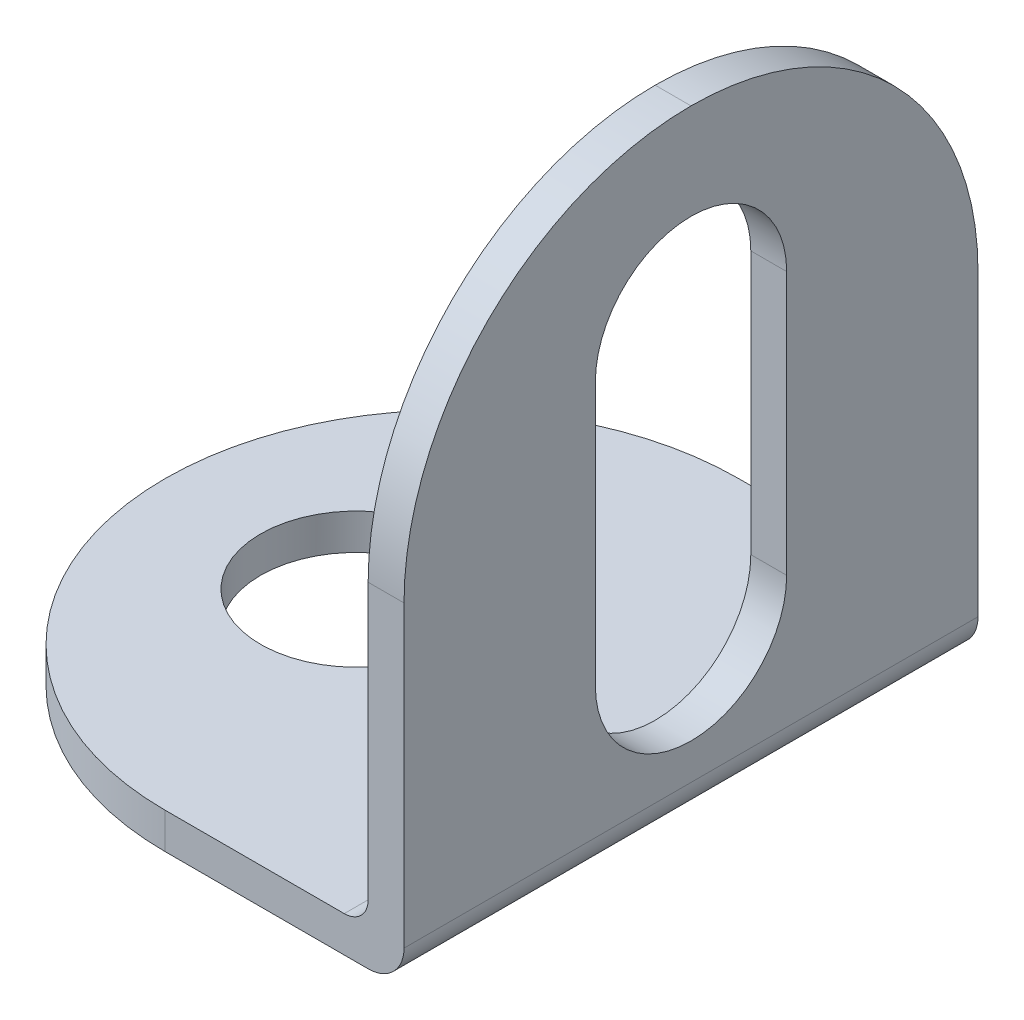
from build123d import *

# Parameters (mm, degrees)
ESTRUSIONE_SOTTILE1_DEPTH = 6
RACCORDO3_R               = 6
SCHIZZO4_R                = 2
TAGLIO_ESTRUSIONE1_DEPTH  = 0.75
RACCORDO1_R               = 0.75
RACCORDO2_R               = 0.5
TAGLIO_ESTRUSIONE2_DEPTH  = 0.75


with BuildPart() as part:
    # Schizzo1 → Estrusione-Sottile1 (new, symmetric)
    with BuildSketch(Plane.XY):
        Polygon((0, 13), (0, 0), (-11, 0), (-11, 0.75), (-0.75, 0.75), (-0.75, 13), align=None)
    extrude(amount=ESTRUSIONE_SOTTILE1_DEPTH, both=True)

    # Raccordo3
    raccordo3_edges = [part.edges().sort_by_distance(p)[0] for p in [
        (-11, 0.375, 6),
        (-11, 0.375, -6),
        (-0.375, 13, -6),
        (-0.375, 13, 6),
    ]]
    fillet(raccordo3_edges, radius=RACCORDO3_R - 0.0001)  # a hair under: the kernel refuses the full size

    # Schizzo4 → Taglio-Estrusione1 (cut)
    with BuildSketch(Plane(origin=(0, 0.75, 0), x_dir=(1, 0, 0), z_dir=(0, 1, 0))):
        with Locations(Location((-7, 0, 0), (0, 0, 180))):
            Circle(SCHIZZO4_R)
    extrude(amount=-TAGLIO_ESTRUSIONE1_DEPTH, mode=Mode.SUBTRACT)

    # Raccordo1
    raccordo1_edges = [part.edges().sort_by_distance(p)[0] for p in [
        (0, 0, 0),
    ]]
    fillet(raccordo1_edges, radius=RACCORDO1_R)

    # Raccordo2
    raccordo2_edges = [part.edges().sort_by_distance(p)[0] for p in [
        (-0.75, 0.75, 0),
    ]]
    fillet(raccordo2_edges, radius=RACCORDO2_R)

    # Schizzo5 → Taglio-Estrusione2 (cut)
    with BuildSketch(Plane.ZY.offset(0.75)):
        with BuildLine():
            Line((2, 9), (2, 3.5))
            ThreePointArc((2, 3.5), (0, 1.5), (-2, 3.5))
            Line((-2, 3.5), (-2, 9))
            ThreePointArc((-2, 9), (0, 11), (2, 9))
        make_face()
    extrude(amount=-TAGLIO_ESTRUSIONE2_DEPTH, mode=Mode.SUBTRACT)


solid = part.part
